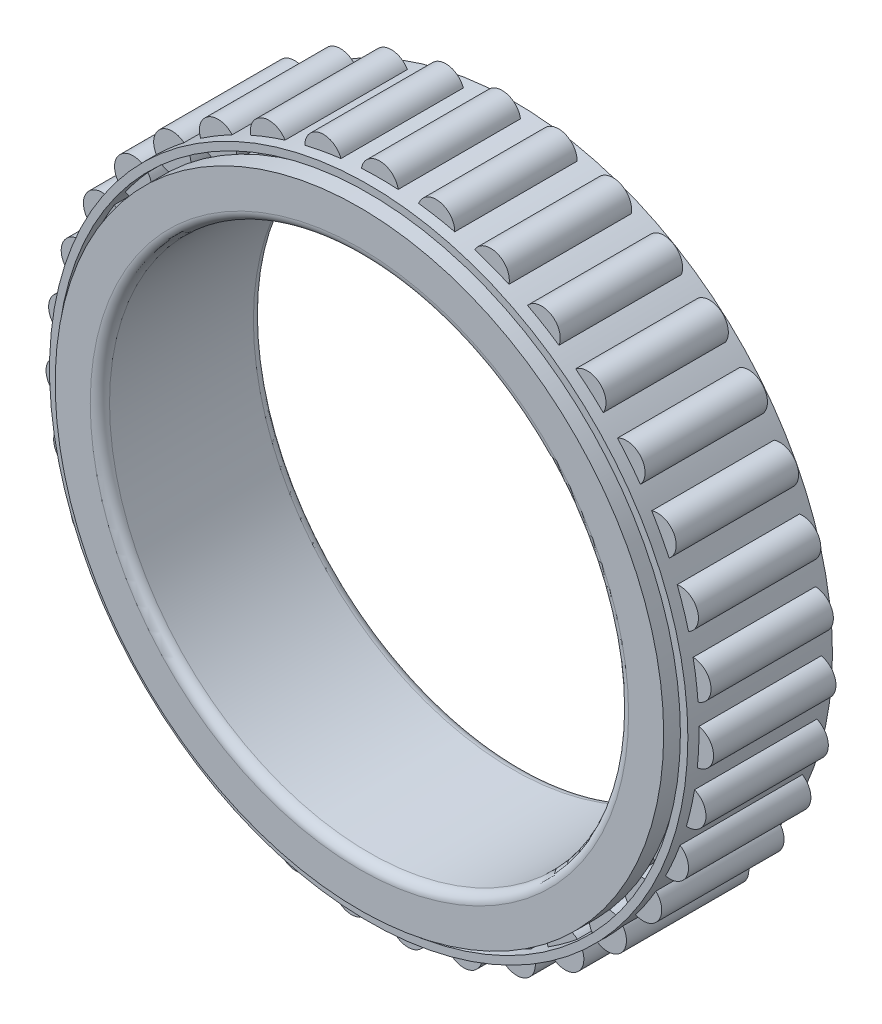
from build123d import *

# Parameters (mm, degrees)
BASESKE_W            = 16.5
BASESKE_H            = 2.5125
CAGESKE_W            = 19.5
CAGESKE_H            = 1.005
FILLET1_R            = 1.3
CIRPATTERNBALL_COUNT = 35


with BuildPart() as part:
    # BaseSke → Roller (revolve)
    with BuildSketch(Plane(origin=(0, 0, 0), x_dir=(0, 0, -1), z_dir=(1, 0, 0))):
        with Locations((0, 41.28125)):
            Rectangle(BASESKE_W, BASESKE_H)
    roller = revolve(axis=Axis((0, 42.5375, 8.25), (0, 0, -1)))

    # OuterRaceSke → OuterRace (revolve)
    with BuildSketch(Plane(origin=(0, 0, 0), x_dir=(0, 0, -1), z_dir=(1, 0, 0))):
        Polygon((-11, 35), (11, 35), (11, 41.03), (8.275, 41.03), (8.275, 40.045), (-8.275, 40.045), (-8.275, 41.03), (-11, 41.03), align=None)
    revolve(axis=Axis((0, 0, 50.391616343), (0, 0, -1)))

    # CageSke → Cage (revolve)
    with BuildSketch(Plane(origin=(0, 0, 0), x_dir=(0, 0, -1), z_dir=(1, 0, 0))):
        with Locations((0, 42.5375)):
            Rectangle(CAGESKE_W, CAGESKE_H)
    revolve(axis=Axis((0, 0, 70.862590906), (0, 0, -1)))

    # Fillet1
    fillet1_edges = [part.edges().sort_by_distance(p)[0] for p in [
        (0, -35, -11),
        (0, -35, 11),
    ]]
    fillet(fillet1_edges, radius=FILLET1_R)

    # CirPatternBall: Roller ×35 about axis
    cirpatternball_axis = Axis((0, 0, 50.391616343), (0, 0, -1))
    for i in range(1, CIRPATTERNBALL_COUNT):
        add(roller.rotate(cirpatternball_axis, i * 360 / CIRPATTERNBALL_COUNT))


solid = part.part
